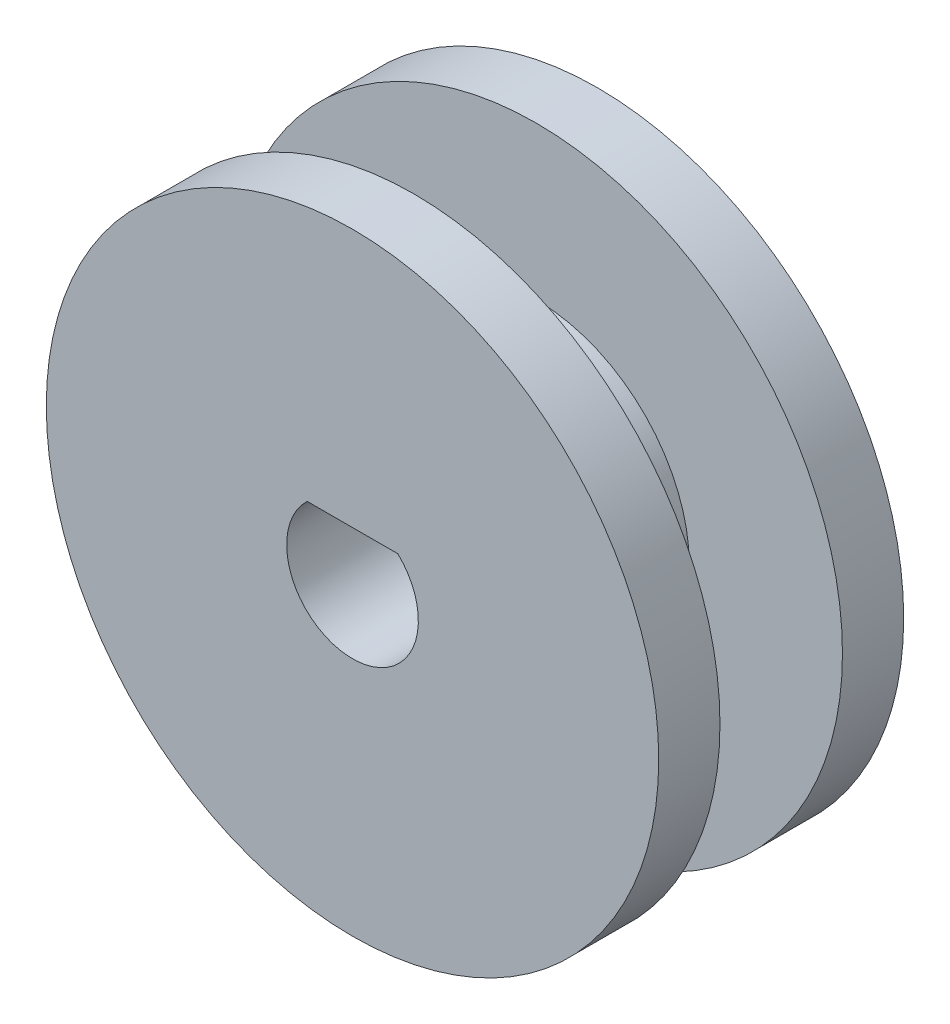
from build123d import *

# Parameters (mm, degrees)
SKETCH1_R           = 10
BOSS_EXTRUDE1_DEPTH = 2
SKETCH2_R           = 5
BOSS_EXTRUDE2_DEPTH = 4
SKETCH3_R           = 10
BOSS_EXTRUDE3_DEPTH = 2
CUT_EXTRUDE1_DEPTH  = 17.248076809


with BuildPart() as part:
    # Sketch1 → Boss-Extrude1 (new body)
    with BuildSketch(Plane.XY):
        Circle(SKETCH1_R)
    extrude(amount=BOSS_EXTRUDE1_DEPTH)

    # Sketch2 → Boss-Extrude2 (add)
    with BuildSketch(Plane.XY.offset(2)):
        Circle(SKETCH2_R)
    extrude(amount=BOSS_EXTRUDE2_DEPTH)

    # Sketch3 → Boss-Extrude3 (add)
    with BuildSketch(Plane.XY.offset(6)):
        Circle(SKETCH3_R)
    extrude(amount=BOSS_EXTRUDE3_DEPTH)

    # Sketch6 → Cut-Extrude1 (cut, through all)
    with BuildSketch(Plane.XY.offset(8)):
        with BuildLine():
            Line((1.479493156, 1.56), (-1.479493156, 1.56))
            ThreePointArc((-1.479493156, 1.56), (-0.848996382, -1.975273435), (2.15, 0))
            ThreePointArc((2.15, 0), (1.975273435, 0.848996382), (1.479493156, 1.56))
        make_face()
    extrude(amount=-CUT_EXTRUDE1_DEPTH, mode=Mode.SUBTRACT)


solid = part.part
